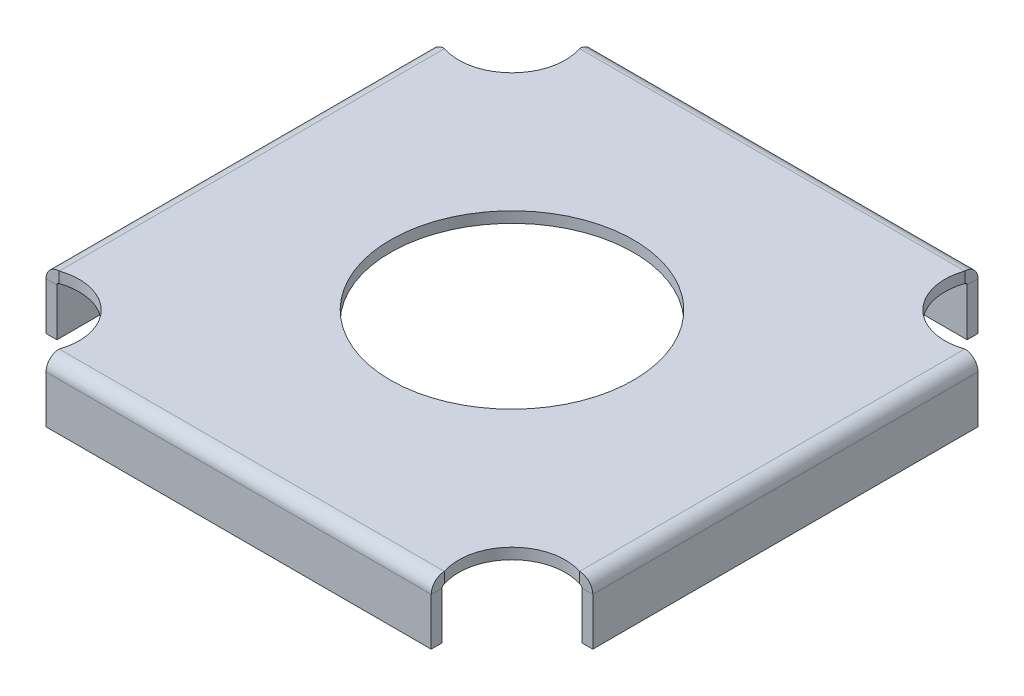
from build123d import *

# Parameters (mm, degrees)
SKETCH3_R                 = 38.1
BASE_FLANGE1_DEPTH        = 3.4163
EDGE_FLANGE1_DEPTH        = 120.765617952
EDGE_FLANGE1_BEND_DEPTH   = 120.765617952
EDGE_FLANGE1_BEND_2_DEPTH = 120.765617952
EDGE_FLANGE1_BEND_3_DEPTH = 120.765617952


# Sheet-metal steps are written as plain solids
with BuildPart() as part:
    # Sketch3 → Base-Flange1 (new body)
    with BuildSketch(Plane(origin=(0, 0, 0), x_dir=(1, 0, 0), z_dir=(0, 1, 0))):
        with BuildLine():
            Line((-60.382808976, 81.5594), (60.382808976, 81.5594))
            ThreePointArc((60.382808976, 81.5594), (64.390963201, 64.390963201), (81.5594, 60.382808976))
            Line((81.5594, 60.382808976), (81.5594, -60.382808976))
            ThreePointArc((81.5594, -60.382808976), (64.390963201, -64.390963201), (60.382808976, -81.5594))
            Line((60.382808976, -81.5594), (-60.382808976, -81.5594))
            ThreePointArc((-60.382808976, -81.5594), (-64.390963201, -64.390963201), (-81.5594, -60.382808976))
            Line((-81.5594, -60.382808976), (-81.5594, 60.382808976))
            ThreePointArc((-81.5594, 60.382808976), (-64.390963201, 64.390963201), (-60.382808976, 81.5594))
        make_face()
        with Locations(Location((0, 0, 0), (0, 0, 270))):
            Circle(SKETCH3_R, mode=Mode.SUBTRACT)
    extrude(amount=-BASE_FLANGE1_DEPTH)

    # Edge-Flange1 section (across the edge) → Edge-Flange1 (add)
    with BuildSketch(Plane(origin=(60.382808976, -3.4163, 82.296), x_dir=(0, 0, -1), z_dir=(-1, 0, 0))):
        with BuildLine():
            Line((-3.4163, 0.7366), (-3.4163, 15.6337))
            Line((-3.4163, 15.6337), (0, 15.6337))
            Line((0, 15.6337), (0, 0.7366))
            ThreePointArc((0, 0.7366), (0.215745145, 0.215745145), (0.7366, 0))
            Line((0.7366, 0), (0.7366, -3.4163))
            ThreePointArc((0.7366, -3.4163), (-2.199943752, -2.199943752), (-3.4163, 0.7366))
        make_face()
    extrude(amount=EDGE_FLANGE1_DEPTH)

    # Edge-Flange1 section 2 (across the edge) → Edge-Flange1 bend (add)
    with BuildSketch(Plane(origin=(82.296, -3.4163, -60.382808976), x_dir=(-1, 0, 0), z_dir=(0, 0, 1))):
        with BuildLine():
            Line((-3.4163, 0.7366), (-3.4163, 15.6337))
            Line((-3.4163, 15.6337), (0, 15.6337))
            Line((0, 15.6337), (0, 0.7366))
            ThreePointArc((0, 0.7366), (0.215745145, 0.215745145), (0.7366, 0))
            Line((0.7366, 0), (0.7366, -3.4163))
            ThreePointArc((0.7366, -3.4163), (-2.199943752, -2.199943752), (-3.4163, 0.7366))
        make_face()
    extrude(amount=EDGE_FLANGE1_BEND_DEPTH)

    # Edge-Flange1 section 3 (across the edge) → Edge-Flange1 bend 2 (add)
    with BuildSketch(Plane(origin=(-60.382808976, -3.4163, -82.296), x_dir=(0, 0, 1), z_dir=(1, 0, 0))):
        with BuildLine():
            Line((-3.4163, 0.7366), (-3.4163, 15.6337))
            Line((-3.4163, 15.6337), (0, 15.6337))
            Line((0, 15.6337), (0, 0.7366))
            ThreePointArc((0, 0.7366), (0.215745145, 0.215745145), (0.7366, 0))
            Line((0.7366, 0), (0.7366, -3.4163))
            ThreePointArc((0.7366, -3.4163), (-2.199943752, -2.199943752), (-3.4163, 0.7366))
        make_face()
    extrude(amount=EDGE_FLANGE1_BEND_2_DEPTH)

    # Edge-Flange1 section 4 (across the edge) → Edge-Flange1 bend 3 (add)
    with BuildSketch(Plane(origin=(-82.296, -3.4163, 60.382808976), x_dir=(1, 0, 0), z_dir=(0, 0, -1))):
        with BuildLine():
            Line((-3.4163, 0.7366), (-3.4163, 15.6337))
            Line((-3.4163, 15.6337), (0, 15.6337))
            Line((0, 15.6337), (0, 0.7366))
            ThreePointArc((0, 0.7366), (0.215745145, 0.215745145), (0.7366, 0))
            Line((0.7366, 0), (0.7366, -3.4163))
            ThreePointArc((0.7366, -3.4163), (-2.199943752, -2.199943752), (-3.4163, 0.7366))
        make_face()
    extrude(amount=EDGE_FLANGE1_BEND_3_DEPTH)


solid = part.part
